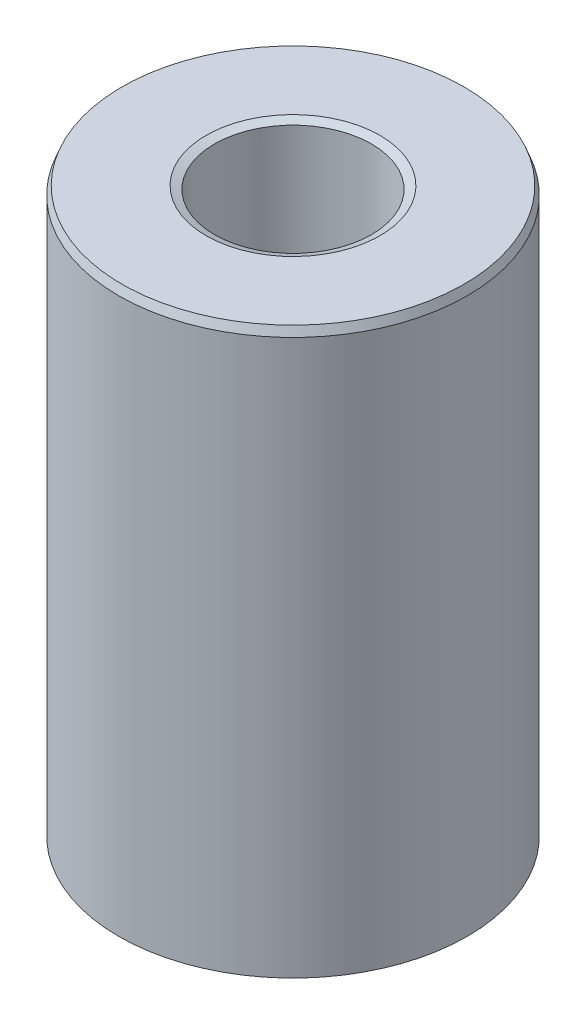
from build123d import *
from OCP.BRepFilletAPI import BRepFilletAPI_MakeChamfer

# Parameters (mm, degrees)
SKETCH1_R           = 40
BOSS_EXTRUDE1_DEPTH = 130.047355791
SKETCH2_R           = 18.03790193
CUT_EXTRUDE1_DEPTH  = 142.817892905
CHAMFER1_SIZE       = 1.92334846
CHAMFER1_SIZE2      = 0.740756808


with BuildPart() as part:
    # Sketch1 → Boss-Extrude1 (new body)
    with BuildSketch(Plane(origin=(0, 0, 0), x_dir=(1, 0, 0), z_dir=(0, 1, 0))):
        Circle(SKETCH1_R)
    extrude(amount=BOSS_EXTRUDE1_DEPTH)

    # Sketch2 → Cut-Extrude1 (cut, through all)
    with BuildSketch(Plane(origin=(0, 0, 0), x_dir=(1, 0, 0), z_dir=(0, 1, 0))):
        Circle(SKETCH2_R)
    extrude(amount=CUT_EXTRUDE1_DEPTH, mode=Mode.SUBTRACT)

    # Chamfer1: one chamfer whose edges measure the first distance from different faces: ONE call of the kernel's chamfer builder (chamfer() names one face for all edges)
    chamfer1_edges_1 = [part.edges().sort_by_distance(p)[0] for p in [
        (-18.03790193, 130.047355791, 0),
    ]]
    chamfer1_side_1 = [part.faces().sort_by_distance(p)[0] for p in [
        (-38.86862915, 130.047355791, 0),
    ]]
    chamfer1_edges_2 = [part.edges().sort_by_distance(p)[0] for p in [
        (-18.03790193, 0, 0),
    ]]
    chamfer1_side_2 = [part.faces().sort_by_distance(p)[0] for p in [
        (-18.03790193, 65.023677895, 0),
    ]]
    chamfer1_edges_3 = [part.edges().sort_by_distance(p)[0] for p in [
        (-40, 0, 0),
    ]]
    chamfer1_side_3 = [part.faces().sort_by_distance(p)[0] for p in [
        (-38.86862915, 0, 0),
    ]]
    chamfer1_edges_4 = [part.edges().sort_by_distance(p)[0] for p in [
        (-40, 130.047355791, 0),
    ]]
    chamfer1_side_4 = [part.faces().sort_by_distance(p)[0] for p in [
        (-40, 65.023677895, 0),
    ]]
    chamfer1 = BRepFilletAPI_MakeChamfer(part.part.solid().wrapped)
    for e in chamfer1_edges_1:
        chamfer1.Add(CHAMFER1_SIZE, CHAMFER1_SIZE2, e.wrapped, chamfer1_side_1[0].wrapped)  # the first distance lies on this face
    for e in chamfer1_edges_2:
        chamfer1.Add(CHAMFER1_SIZE, CHAMFER1_SIZE2, e.wrapped, chamfer1_side_2[0].wrapped)  # the first distance lies on this face
    for e in chamfer1_edges_3:
        chamfer1.Add(CHAMFER1_SIZE, CHAMFER1_SIZE2, e.wrapped, chamfer1_side_3[0].wrapped)  # the first distance lies on this face
    for e in chamfer1_edges_4:
        chamfer1.Add(CHAMFER1_SIZE, CHAMFER1_SIZE2, e.wrapped, chamfer1_side_4[0].wrapped)  # the first distance lies on this face
    add(Compound.cast(chamfer1.Shape()), mode=Mode.REPLACE)


solid = part.part
